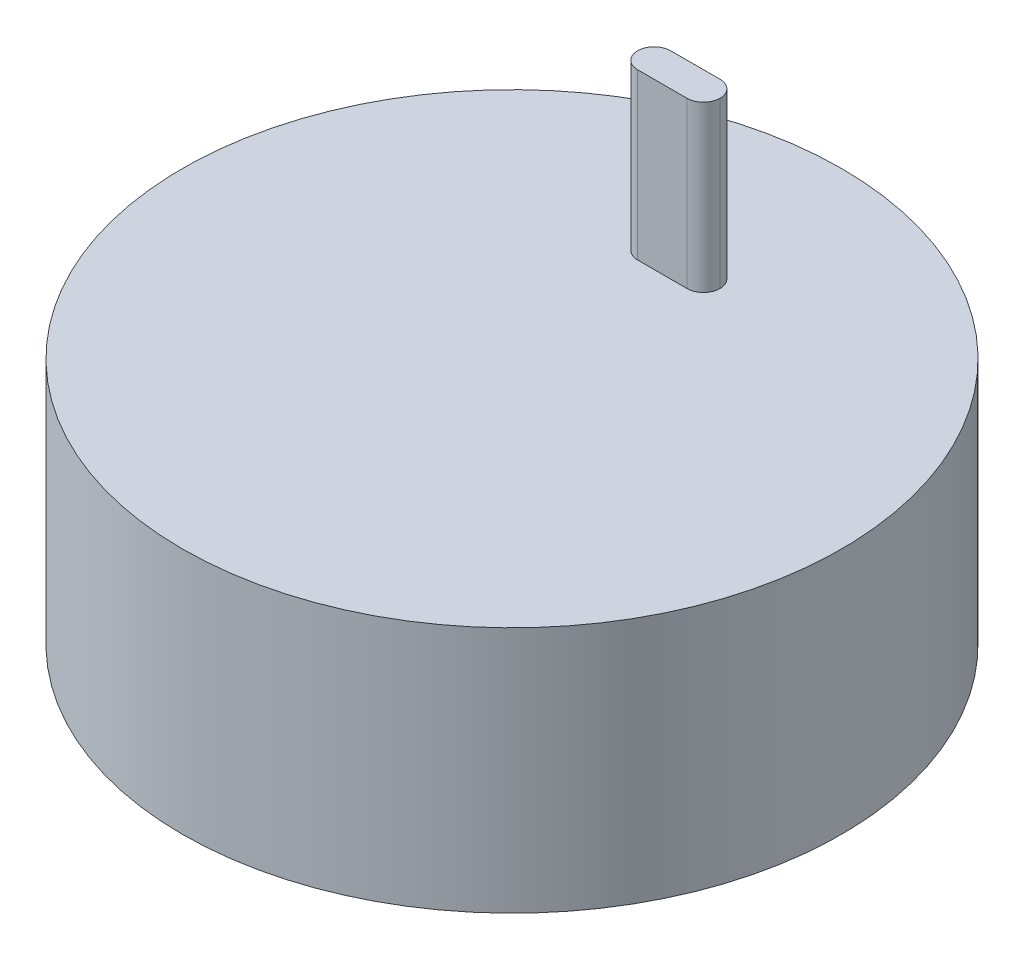
from build123d import *

# Parameters (mm, degrees)
SKETCH1_R           = 20
BOSS_EXTRUDE1_DEPTH = 15
SKETCH2_W           = 5
SKETCH2_H           = 2
BOSS_EXTRUDE2_DEPTH = 10
FILLET1_R           = 1


with BuildPart() as part:
    # Sketch1 → Boss-Extrude1 (new body)
    with BuildSketch(Plane(origin=(0, 0, 0), x_dir=(1, 0, 0), z_dir=(0, 1, 0))):
        with Locations(Location((0, 0, 0), (0, 0, 270))):
            Circle(SKETCH1_R)
    extrude(amount=BOSS_EXTRUDE1_DEPTH)

    # Sketch2 → Boss-Extrude2 (add)
    with BuildSketch(Plane(origin=(0, 15, 0), x_dir=(1, 0, 0), z_dir=(0, 1, 0))):
        with Locations((0.125263177, 10)):
            Rectangle(SKETCH2_W, SKETCH2_H)
    extrude(amount=BOSS_EXTRUDE2_DEPTH)

    # Fillet1
    fillet1_edges = [part.edges().sort_by_distance(p)[0] for p in [
        (-2.374736823, 20, -11),
        (2.625263177, 20, -11),
        (-2.374736823, 20, -9),
        (2.625263177, 20, -9),
    ]]
    fillet(fillet1_edges, radius=FILLET1_R - 0.0001)  # a hair under: the kernel refuses the full size


solid = part.part
